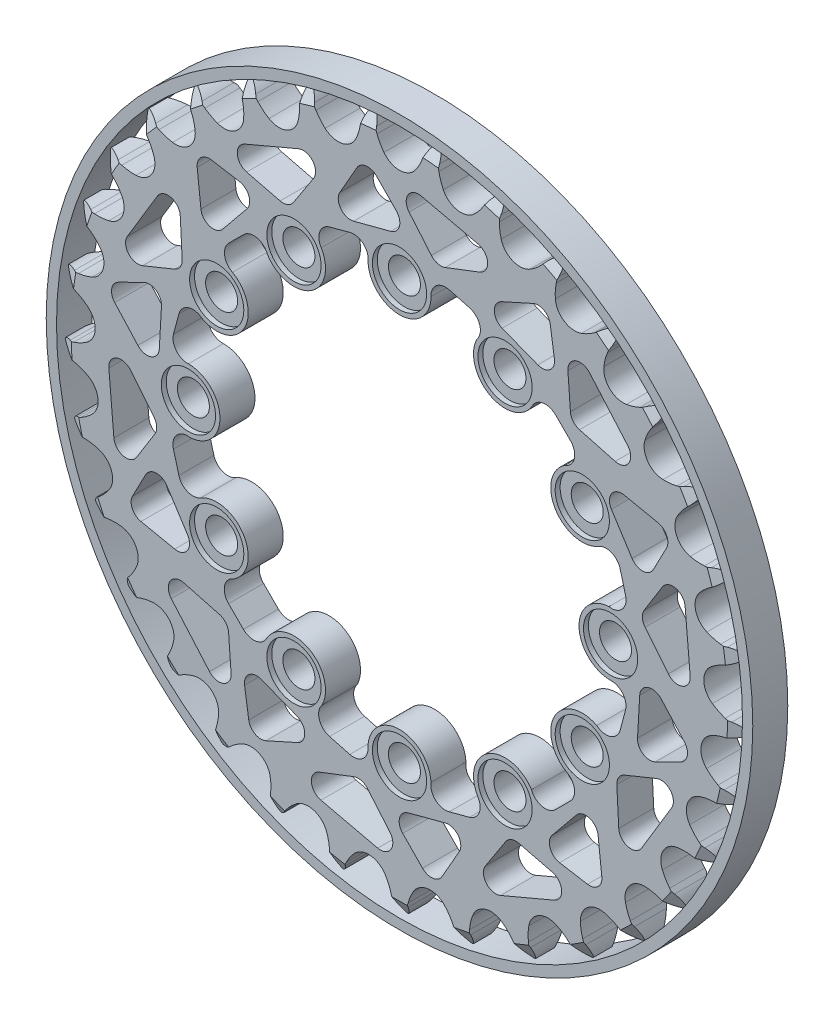
from build123d import *

# Parameters (mm, degrees)
EXTRUSION_DEPTH         = 7.2136
CIRPATTERN1_COUNT       = 12
CUT_EXTRUDE1_DEPTH      = 101.397293257
CUT_EXTRUDE1_DEPTH_BACK = 101.397293257
SKETCH8_R               = 37
CUT_EXTRUDE2_START      = 7.2136
SKETCH10_R              = 5.588
CUT_EXTRUDE2_DEPTH      = 1.016
CIRPATTERN2_COUNT       = 12
CUT_EXTRUDE3_DEPTH      = 101.397293405
CIRPATTERN3_COUNT       = 12
CUT_EXTRUDE4_DEPTH      = 101.397293405
CIRPATTERN5_COUNT       = 10
SKETCH16_R              = 72.810185918
SKETCH16_R_2            = 70.692441337
BOSS_EXTRUDE1_DEPTH     = 7.2136


with BuildPart() as part:
    # Teeth Sketch → Extrusion (new body)
    with BuildSketch(Plane.XY):
        with BuildLine():
            Line((5.022388138, 68.006393031), (4.635162245, 66.971544668))
            ThreePointArc((4.635162245, 66.971544668), (4.0137299, 65.635158722), (3.209237245, 64.400291471))
            ThreePointArc((3.209237245, 64.400291471), (0, 62.793862006), (-3.209237245, 64.400291471))
            ThreePointArc((-3.209237245, 64.400291471), (-4.0137299, 65.635158722), (-4.635162245, 66.971544668))
            Line((-4.635162245, 66.971544668), (-5.022388138, 68.006393031))
            ThreePointArc((-5.022388138, 68.006393031), (-5.727412099, 69.369502295), (-6.734552875, 70.527428506))
            ThreePointArc((-6.734552875, 70.527428506), (-7.504354329, 69.199824885), (-7.938667464, 67.727922119))
            Line((-7.938667464, 67.727922119), (-8.123049341, 66.638491832))
            ThreePointArc((-8.123049341, 66.638491832), (-8.48033889, 65.208649276), (-9.036593151, 63.84384645))
            ThreePointArc((-9.036593151, 63.84384645), (-11.883816523, 61.659095115), (-15.339077445, 62.629142165))
            ThreePointArc((-15.339077445, 62.629142165), (-16.362732034, 63.68944252), (-17.22584699, 64.884071387))
            Line((-17.22584699, 64.884071387), (-17.801921547, 65.826935709))
            ThreePointArc((-17.801921547, 65.826935709), (-18.752174931, 67.031985151), (-19.960254337, 67.978383482))
            ThreePointArc((-19.960254337, 67.978383482), (-20.464893839, 66.529085505), (-20.61279894, 65.001587639))
            Line((-20.61279894, 65.001587639), (-20.587672758, 63.896950277))
            ThreePointArc((-20.587672758, 63.896950277), (-20.667906137, 62.425329346), (-20.955817525, 60.979918474))
            ThreePointArc((-20.955817525, 60.979918474), (-23.338120953, 58.295807876), (-26.914523421, 58.594412483))
            ThreePointArc((-26.914523421, 58.594412483), (-28.120342399, 59.441823925), (-29.193944743, 60.451518712))
            Line((-29.193944743, 60.451518712), (-29.938047129, 61.268321421))
            ThreePointArc((-29.938047129, 61.268321421), (-31.099185303, 62.271757414), (-32.464540202, 62.972422563))
            ThreePointArc((-32.464540202, 62.972422563), (-32.685778765, 61.453811636), (-32.541930156, 59.925926421))
            Line((-32.541930156, 59.925926421), (-32.308204042, 58.846006456))
            ThreePointArc((-32.308204042, 58.846006456), (-32.108481407, 57.385795366), (-32.117644055, 55.912017363))
            ThreePointArc((-32.117644055, 55.912017363), (-33.948924886, 52.825558252), (-37.517208396, 52.441928068))
            ThreePointArc((-37.517208396, 52.441928068), (-38.861610323, 53.045822938), (-40.106897269, 53.834090646))
            Line((-40.106897269, 53.834090646), (-40.992133685, 54.495310364))
            ThreePointArc((-40.992133685, 54.495310364), (-42.32219009, 55.260866117), (-43.795472998, 55.69047422))
            ThreePointArc((-43.795472998, 55.69047422), (-43.725314484, 54.157436897), (-43.294911229, 52.684386087))
            Line((-43.294911229, 52.684386087), (-42.861032653, 51.668214641))
            ThreePointArc((-42.861032653, 51.668214641), (-42.388572501, 50.272189225), (-42.118655247, 48.823310267))
            ThreePointArc((-42.118655247, 48.823310267), (-43.33272622, 45.446055318), (-46.763923708, 44.394055736))
            ThreePointArc((-46.763923708, 44.394055736), (-48.198318397, 44.732607702), (-49.570282031, 45.270958281))
            Line((-49.570282031, 45.270958281), (-50.564657725, 45.752696804))
            ThreePointArc((-50.564657725, 45.752696804), (-52.015560657, 46.252703137), (-53.543523293, 46.395727039))
            ThreePointArc((-53.543523293, 46.395727039), (-53.184503413, 44.903671283), (-52.483101407, 43.538694772))
            Line((-52.483101407, 43.538694772), (-51.864751871, 42.622998928))
            ThreePointArc((-51.864751871, 42.622998928), (-51.136630142, 41.341615182), (-50.597388499, 39.970001531))
            ThreePointArc((-50.597388499, 39.970001531), (-51.150369926, 36.424013535), (-54.320468976, 34.741666562))
            ThreePointArc((-54.320468976, 34.741666562), (-55.793013665, 34.802639473), (-57.242067645, 35.071615531))
            Line((-57.242067645, 35.071615531), (-58.309643291, 35.356461573))
            ThreePointArc((-58.309643291, 35.356461573), (-59.828953337, 35.572846956), (-61.356371149, 35.424117399))
            ThreePointArc((-61.356371149, 35.424117399), (-60.721465817, 34.026969994), (-59.774415556, 32.819401589))
            Line((-59.774415556, 32.819401589), (-58.993943824, 32.037276981))
            ThreePointArc((-58.993943824, 32.037276981), (-58.036476735, 30.916847451), (-57.2474003, 29.672072798))
            ThreePointArc((-57.2474003, 29.672072798), (-57.119305992, 26.085513002), (-59.913730964, 23.83362304))
            ThreePointArc((-59.913730964, 23.83362304), (-61.371204052, 23.614813176), (-62.844975793, 23.604693218))
            Line((-62.844975793, 23.604693218), (-63.947166423, 23.682351702))
            ThreePointArc((-63.947166423, 23.682351702), (-65.479971761, 23.607295402), (-66.951639889, 23.17218786))
            ThreePointArc((-66.951639889, 23.17218786), (-66.063796239, 21.920445353), (-64.905326586, 20.913929722))
            Line((-64.905326586, 20.913929722), (-63.99094094, 20.293644371))
            ThreePointArc((-63.99094094, 20.293644371), (-62.838733846, 19.374664301), (-61.828341898, 18.301718044))
            ThreePointArc((-61.828341898, 18.301718044), (-61.023801517, 14.804214063), (-63.341554612, 12.064170283))
            ThreePointArc((-63.341554612, 12.064170283), (-64.731279223, 11.573486003), (-66.176502774, 11.28463579))
            Line((-66.176502774, 11.28463579), (-67.273472348, 11.152299936))
            ThreePointArc((-67.273472348, 11.152299936), (-68.764373399, 10.788514683), (-70.127101923, 10.082755077))
            ThreePointArc((-70.127101923, 10.082755077), (-69.018408937, 9.021658703), (-67.690390004, 8.252573944))
            Line((-67.690390004, 8.252573944), (-66.675138724, 7.816546579))
            ThreePointArc((-66.675138724, 7.816546579), (-65.369835391, 7.132230303), (-64.174646128, 6.269891516))
            ThreePointArc((-64.174646128, 6.269891516), (-62.722737859, 2.987852256), (-64.480049441, -0.14131302))
            ThreePointArc((-64.480049441, -0.14131302), (-65.751797307, -0.886137108), (-67.116238523, -1.443277777))
            Line((-67.116238523, -1.443277777), (-68.168339704, -1.780825007))
            ThreePointArc((-68.168339704, -1.780825007), (-69.563451418, -2.420191065), (-70.767987779, -3.371094744))
            ThreePointArc((-70.767987779, -3.371094744), (-69.478516511, -4.203194198), (-68.028946362, -4.707051357))
            Line((-68.028946362, -4.707051357), (-66.949523274, -4.943061572))
            ThreePointArc((-66.949523274, -4.943061572), (-65.538300765, -5.367981082), (-64.201511441, -5.988545228))
            ThreePointArc((-64.201511441, -5.988545228), (-62.154711032, -8.936498316), (-63.288067282, -12.341688903))
            ThreePointArc((-63.288067282, -12.341688903), (-64.395874122, -13.313732915), (-65.630218543, -14.119027525))
            Line((-65.630218543, -14.119027525), (-66.599425651, -14.649586294))
            ThreePointArc((-66.599425651, -14.649586294), (-67.848325057, -15.541424803), (-68.851134172, -16.703104419))
            ThreePointArc((-68.851134172, -16.703104419), (-67.427489473, -17.276132709), (-65.908759351, -17.496551559))
            Line((-65.908759351, -17.496551559), (-64.804177617, -17.524014599))
            ThreePointArc((-64.804177617, -17.524014599), (-63.338041192, -17.674179644), (-61.907966855, -18.030540344))
            ThreePointArc((-61.907966855, -18.030540344), (-59.340251006, -20.537860555), (-59.808689476, -24.096003993))
            ThreePointArc((-59.808689476, -24.096003993), (-60.712516265, -25.260135726), (-61.772151467, -26.284478831))
            Line((-61.772151467, -26.284478831), (-62.623434833, -26.988873364))
            ThreePointArc((-62.623434833, -26.988873364), (-63.680983452, -28.100950955), (-64.445821187, -29.43142038))
            ThreePointArc((-64.445821187, -29.43142038), (-62.939457285, -29.724666771), (-61.406458053, -29.6536808))
            Line((-61.406458053, -29.6536808), (-60.316640136, -29.471604079))
            ThreePointArc((-60.316640136, -29.471604079), (-58.848579784, -29.341587304), (-57.376907048, -29.420864754))
            ThreePointArc((-57.376907048, -29.420864754), (-54.381079699, -31.396931003), (-54.167669802, -34.979426717))
            ThreePointArc((-54.167669802, -34.979426717), (-54.834849884, -36.293571418), (-55.681477891, -37.499940589))
            Line((-55.681477891, -37.499940589), (-56.384069915, -38.352712231))
            ThreePointArc((-56.384069915, -38.352712231), (-57.212045185, -39.644835523), (-57.711268312, -41.096008126))
            ThreePointArc((-57.711268312, -41.096008126), (-56.176629123, -41.09887393), (-54.684767369, -40.739048756))
            Line((-54.684767369, -40.739048756), (-53.649102126, -40.354013001))
            ThreePointArc((-53.649102126, -40.354013001), (-52.232177374, -39.94851355), (-50.772096325, -39.747842457))
            ThreePointArc((-50.772096325, -39.747842457), (-47.456434483, -41.12123456), (-46.56888941, -44.598601821))
            ThreePointArc((-46.56888941, -44.598601821), (-46.975309158, -46.015262876), (-47.578330627, -47.360056788))
            Line((-47.578330627, -47.360056788), (-48.106837804, -48.330384151))
            ThreePointArc((-48.106837804, -48.330384151), (-48.675314541, -49.755852442), (-48.890879835, -51.275279063))
            ThreePointArc((-48.890879835, -51.275279063), (-47.383431219, -50.987660703), (-45.986626711, -50.352001344))
            Line((-45.986626711, -50.352001344), (-45.042545785, -49.777922752))
            ThreePointArc((-45.042545785, -49.777922752), (-43.727967985, -49.111596431), (-42.332249756, -48.638229571))
            ThreePointArc((-42.332249756, -48.638229571), (-38.816590078, -49.35930956), (-37.28698802, -52.605867255))
            ThreePointArc((-37.28698802, -52.605867255), (-37.417958367, -54.073842843), (-37.75557853, -55.50845714))
            Line((-37.75557853, -55.50845714), (-38.090899233, -56.561270064))
            ThreePointArc((-38.090899233, -56.561270064), (-38.379331208, -58.068563217), (-38.303447577, -59.601327819))
            ThreePointArc((-38.303447577, -59.601327819), (-36.877672653, -59.03362057), (-35.626409548, -58.145101414))
            Line((-35.626409548, -58.145101414), (-34.808034481, -57.402728679))
            ThreePointArc((-34.808034481, -57.402728679), (-33.6433159, -56.499658259), (-32.362405386, -55.770704343))
            ThreePointArc((-32.362405386, -55.770704343), (-28.773812973, -55.813410509), (-26.657437732, -58.711819583))
            ThreePointArc((-26.657437732, -58.711819583), (-26.508225068, -60.178053241), (-26.568241455, -61.650637225))
            Line((-26.568241455, -61.650637225), (-26.69825632, -62.747884308))
            ThreePointArc((-26.69825632, -62.747884308), (-26.696218847, -64.28252482), (-26.331628924, -65.773229298))
            ThreePointArc((-26.331628924, -65.773229298), (-25.039058915, -64.94595158), (-23.978561119, -63.836686022))
            Line((-23.978561119, -63.836686022), (-23.31547012, -62.952850431))
            ThreePointArc((-23.31547012, -62.952850431), (-22.342706722, -61.845675228), (-21.222899365, -60.887480551))
            ThreePointArc((-21.222899365, -60.887480551), (-17.691075297, -60.250269381), (-15.06441819, -62.69577378))
            ThreePointArc((-15.06441819, -62.69577378), (-14.640415448, -64.107272002), (-14.42065891, -65.564602652))
            Line((-14.42065891, -65.564602652), (-14.340668861, -66.666626525))
            ThreePointArc((-14.340668861, -66.666626525), (-14.048235582, -68.17314849), (-13.408116596, -69.567914899))
            ThreePointArc((-13.408116596, -69.567914899), (-12.295468348, -68.510966685), (-11.464065017, -67.221046473))
            Line((-11.464065017, -67.221046473), (-10.980223921, -66.227692145))
            ThreePointArc((-10.980223921, -66.227692145), (-10.23457391, -64.956428358), (-9.316342465, -63.80362457))
            ThreePointArc((-9.316342465, -63.80362457), (-5.968936066, -62.509526537), (-2.926931324, -64.413739359))
            ThreePointArc((-2.926931324, -64.413739359), (-2.24346307, -65.719486924), (-1.751876179, -67.108892511))
            Line((-1.751876179, -67.108892511), (-1.464772265, -68.175863162))
            ThreePointArc((-1.464772265, -68.175863162), (-0.89251248, -69.59981695), (0, -70.848234798))
            ThreePointArc((0, -70.848234798), (0.89251248, -69.59981695), (1.464772265, -68.175863162))
            Line((1.464772265, -68.175863162), (1.751876179, -67.108892511))
            ThreePointArc((1.751876179, -67.108892511), (2.24346307, -65.719486924), (2.926931324, -64.413739359))
            ThreePointArc((2.926931324, -64.413739359), (5.968936066, -62.509526537), (9.316342465, -63.80362457))
            ThreePointArc((9.316342465, -63.80362457), (10.23457391, -64.956428358), (10.980223921, -66.227692145))
            Line((10.980223921, -66.227692145), (11.464065017, -67.221046473))
            ThreePointArc((11.464065017, -67.221046473), (12.295468348, -68.510966685), (13.408116596, -69.567914899))
            ThreePointArc((13.408116596, -69.567914899), (14.048235582, -68.17314849), (14.340668861, -66.666626525))
            Line((14.340668861, -66.666626525), (14.42065891, -65.564602652))
            ThreePointArc((14.42065891, -65.564602652), (14.640415448, -64.107272002), (15.06441819, -62.69577378))
            ThreePointArc((15.06441819, -62.69577378), (17.691075297, -60.250269381), (21.222899365, -60.887480551))
            ThreePointArc((21.222899365, -60.887480551), (22.342706722, -61.845675228), (23.31547012, -62.952850431))
            Line((23.31547012, -62.952850431), (23.978561119, -63.836686022))
            ThreePointArc((23.978561119, -63.836686022), (25.039058915, -64.94595158), (26.331628924, -65.773229298))
            ThreePointArc((26.331628924, -65.773229298), (26.696218847, -64.28252482), (26.69825632, -62.747884308))
            Line((26.69825632, -62.747884308), (26.568241455, -61.650637225))
            ThreePointArc((26.568241455, -61.650637225), (26.508225068, -60.178053241), (26.657437732, -58.711819583))
            ThreePointArc((26.657437732, -58.711819583), (28.773812973, -55.813410509), (32.362405386, -55.770704343))
            ThreePointArc((32.362405386, -55.770704343), (33.6433159, -56.499658259), (34.808034481, -57.402728679))
            Line((34.808034481, -57.402728679), (35.626409548, -58.145101414))
            ThreePointArc((35.626409548, -58.145101414), (36.877672653, -59.03362057), (38.303447577, -59.601327819))
            ThreePointArc((38.303447577, -59.601327819), (38.379331208, -58.068563217), (38.090899233, -56.561270064))
            Line((38.090899233, -56.561270064), (37.75557853, -55.50845714))
            ThreePointArc((37.75557853, -55.50845714), (37.417958367, -54.073842843), (37.28698802, -52.605867255))
            ThreePointArc((37.28698802, -52.605867255), (38.816590078, -49.35930956), (42.332249756, -48.638229571))
            ThreePointArc((42.332249756, -48.638229571), (43.727967985, -49.111596431), (45.042545785, -49.777922752))
            Line((45.042545785, -49.777922752), (45.986626711, -50.352001344))
            ThreePointArc((45.986626711, -50.352001344), (47.383431219, -50.987660703), (48.890879835, -51.275279063))
            ThreePointArc((48.890879835, -51.275279063), (48.675314541, -49.755852442), (48.106837804, -48.330384151))
            Line((48.106837804, -48.330384151), (47.578330627, -47.360056788))
            ThreePointArc((47.578330627, -47.360056788), (46.975309158, -46.015262876), (46.56888941, -44.598601821))
            ThreePointArc((46.56888941, -44.598601821), (47.456434483, -41.12123456), (50.772096325, -39.747842457))
            ThreePointArc((50.772096325, -39.747842457), (52.232177374, -39.94851355), (53.649102126, -40.354013001))
            Line((53.649102126, -40.354013001), (54.684767369, -40.739048756))
            ThreePointArc((54.684767369, -40.739048756), (56.176629123, -41.09887393), (57.711268312, -41.096008126))
            ThreePointArc((57.711268312, -41.096008126), (57.212045185, -39.644835523), (56.384069915, -38.352712231))
            Line((56.384069915, -38.352712231), (55.681477891, -37.499940589))
            ThreePointArc((55.681477891, -37.499940589), (54.834849884, -36.293571418), (54.167669802, -34.979426717))
            ThreePointArc((54.167669802, -34.979426717), (54.381079699, -31.396931003), (57.376907048, -29.420864754))
            ThreePointArc((57.376907048, -29.420864754), (58.848579784, -29.341587304), (60.316640136, -29.471604079))
            Line((60.316640136, -29.471604079), (61.406458053, -29.6536808))
            ThreePointArc((61.406458053, -29.6536808), (62.939457285, -29.724666771), (64.445821187, -29.43142038))
            ThreePointArc((64.445821187, -29.43142038), (63.680983452, -28.100950955), (62.623434833, -26.988873364))
            Line((62.623434833, -26.988873364), (61.772151467, -26.284478831))
            ThreePointArc((61.772151467, -26.284478831), (60.712516265, -25.260135726), (59.808689476, -24.096003993))
            ThreePointArc((59.808689476, -24.096003993), (59.340251006, -20.537860555), (61.907966855, -18.030540344))
            ThreePointArc((61.907966855, -18.030540344), (63.338041192, -17.674179644), (64.804177617, -17.524014599))
            Line((64.804177617, -17.524014599), (65.908759351, -17.496551559))
            ThreePointArc((65.908759351, -17.496551559), (67.427489473, -17.276132709), (68.851134172, -16.703104419))
            ThreePointArc((68.851134172, -16.703104419), (67.848325057, -15.541424803), (66.599425651, -14.649586294))
            Line((66.599425651, -14.649586294), (65.630218543, -14.119027525))
            ThreePointArc((65.630218543, -14.119027525), (64.395874122, -13.313732915), (63.288067282, -12.341688903))
            ThreePointArc((63.288067282, -12.341688903), (62.154711032, -8.936498316), (64.201511441, -5.988545228))
            ThreePointArc((64.201511441, -5.988545228), (65.538300765, -5.367981082), (66.949523274, -4.943061572))
            Line((66.949523274, -4.943061572), (68.028946362, -4.707051357))
            ThreePointArc((68.028946362, -4.707051357), (69.478516511, -4.203194198), (70.767987779, -3.371094744))
            ThreePointArc((70.767987779, -3.371094744), (69.563451418, -2.420191065), (68.168339704, -1.780825007))
            Line((68.168339704, -1.780825007), (67.116238523, -1.443277777))
            ThreePointArc((67.116238523, -1.443277777), (65.751797307, -0.886137108), (64.480049441, -0.14131302))
            ThreePointArc((64.480049441, -0.14131302), (62.722737859, 2.987852256), (64.174646128, 6.269891516))
            ThreePointArc((64.174646128, 6.269891516), (65.369835391, 7.132230303), (66.675138724, 7.816546579))
            Line((66.675138724, 7.816546579), (67.690390004, 8.252573944))
            ThreePointArc((67.690390004, 8.252573944), (69.018408937, 9.021658703), (70.127101923, 10.082755077))
            ThreePointArc((70.127101923, 10.082755077), (68.764373399, 10.788514683), (67.273472348, 11.152299936))
            Line((67.273472348, 11.152299936), (66.176502774, 11.28463579))
            ThreePointArc((66.176502774, 11.28463579), (64.731279223, 11.573486003), (63.341554612, 12.064170283))
            ThreePointArc((63.341554612, 12.064170283), (61.023801517, 14.804214063), (61.828341898, 18.301718044))
            ThreePointArc((61.828341898, 18.301718044), (62.838733846, 19.374664301), (63.99094094, 20.293644371))
            Line((63.99094094, 20.293644371), (64.905326586, 20.913929722))
            ThreePointArc((64.905326586, 20.913929722), (66.063796239, 21.920445353), (66.951639889, 23.17218786))
            ThreePointArc((66.951639889, 23.17218786), (65.479971761, 23.607295402), (63.947166423, 23.682351702))
            Line((63.947166423, 23.682351702), (62.844975793, 23.604693218))
            ThreePointArc((62.844975793, 23.604693218), (61.371204052, 23.614813176), (59.913730964, 23.83362304))
            ThreePointArc((59.913730964, 23.83362304), (57.119305992, 26.085513002), (57.2474003, 29.672072798))
            ThreePointArc((57.2474003, 29.672072798), (58.036476735, 30.916847451), (58.993943824, 32.037276981))
            Line((58.993943824, 32.037276981), (59.774415556, 32.819401589))
            ThreePointArc((59.774415556, 32.819401589), (60.721465817, 34.026969994), (61.356371149, 35.424117399))
            ThreePointArc((61.356371149, 35.424117399), (59.828953337, 35.572846956), (58.309643291, 35.356461573))
            Line((58.309643291, 35.356461573), (57.242067645, 35.071615531))
            ThreePointArc((57.242067645, 35.071615531), (55.793013665, 34.802639473), (54.320468976, 34.741666562))
            ThreePointArc((54.320468976, 34.741666562), (51.150369926, 36.424013535), (50.597388499, 39.970001531))
            ThreePointArc((50.597388499, 39.970001531), (51.136630142, 41.341615182), (51.864751871, 42.622998928))
            Line((51.864751871, 42.622998928), (52.483101407, 43.538694772))
            ThreePointArc((52.483101407, 43.538694772), (53.184503413, 44.903671283), (53.543523293, 46.395727039))
            ThreePointArc((53.543523293, 46.395727039), (52.015560657, 46.252703137), (50.564657725, 45.752696804))
            Line((50.564657725, 45.752696804), (49.570282031, 45.270958281))
            ThreePointArc((49.570282031, 45.270958281), (48.198318397, 44.732607702), (46.763923708, 44.394055736))
            ThreePointArc((46.763923708, 44.394055736), (43.33272622, 45.446055318), (42.118655247, 48.823310267))
            ThreePointArc((42.118655247, 48.823310267), (42.388572501, 50.272189225), (42.861032653, 51.668214641))
            Line((42.861032653, 51.668214641), (43.294911229, 52.684386087))
            ThreePointArc((43.294911229, 52.684386087), (43.725314484, 54.157436897), (43.795472998, 55.69047422))
            ThreePointArc((43.795472998, 55.69047422), (42.32219009, 55.260866117), (40.992133685, 54.495310364))
            Line((40.992133685, 54.495310364), (40.106897269, 53.834090646))
            ThreePointArc((40.106897269, 53.834090646), (38.861610323, 53.045822938), (37.517208396, 52.441928068))
            ThreePointArc((37.517208396, 52.441928068), (33.948924886, 52.825558252), (32.117644055, 55.912017363))
            ThreePointArc((32.117644055, 55.912017363), (32.108481407, 57.385795366), (32.308204042, 58.846006456))
            Line((32.308204042, 58.846006456), (32.541930156, 59.925926421))
            ThreePointArc((32.541930156, 59.925926421), (32.685778765, 61.453811636), (32.464540202, 62.972422563))
            ThreePointArc((32.464540202, 62.972422563), (31.099185303, 62.271757414), (29.938047129, 61.268321421))
            Line((29.938047129, 61.268321421), (29.193944743, 60.451518712))
            ThreePointArc((29.193944743, 60.451518712), (28.120342399, 59.441823925), (26.914523421, 58.594412483))
            ThreePointArc((26.914523421, 58.594412483), (23.338120953, 58.295807876), (20.955817525, 60.979918474))
            ThreePointArc((20.955817525, 60.979918474), (20.667906137, 62.425329346), (20.587672758, 63.896950277))
            Line((20.587672758, 63.896950277), (20.61279894, 65.001587639))
            ThreePointArc((20.61279894, 65.001587639), (20.464893839, 66.529085505), (19.960254337, 67.978383482))
            ThreePointArc((19.960254337, 67.978383482), (18.752174931, 67.031985151), (17.801921547, 65.826935709))
            Line((17.801921547, 65.826935709), (17.22584699, 64.884071387))
            ThreePointArc((17.22584699, 64.884071387), (16.362732034, 63.68944252), (15.339077445, 62.629142165))
            ThreePointArc((15.339077445, 62.629142165), (11.883816523, 61.659095115), (9.036593151, 63.84384645))
            ThreePointArc((9.036593151, 63.84384645), (8.48033889, 65.208649276), (8.123049341, 66.638491832))
            Line((8.123049341, 66.638491832), (7.938667464, 67.727922119))
            ThreePointArc((7.938667464, 67.727922119), (7.504354329, 69.199824885), (6.734552875, 70.527428506))
            ThreePointArc((6.734552875, 70.527428506), (5.727412099, 69.369502295), (5.022388138, 68.006393031))
        make_face()
    extrude(amount=EXTRUSION_DEPTH)

    # Sketch7 → M6 Clearance Hole1 (revolve, cut)
    with BuildSketch(Plane(origin=(0, 43.500000122, 0), x_dir=(0, 1, 0), z_dir=(1, 0, 0))):
        Polygon((0, 0), (0, 19.254840043), (3.3, 17.272), (3.3, 0), align=None)
    m6_clearance_hole1 = revolve(axis=Axis((0, 43.500000122, -6.35), (0, 0, 1)), mode=Mode.SUBTRACT)

    # CirPattern1: M6 Clearance Hole1 ×12 about axis
    cirpattern1_axis = Axis((0, 0, 0), (0, 0, 1))
    for i in range(1, CIRPATTERN1_COUNT):
        add(m6_clearance_hole1.rotate(cirpattern1_axis, i * 360 / CIRPATTERN1_COUNT), mode=Mode.SUBTRACT)

    # Sketch8 → Cut-Extrude1 (cut, two sides: drawn at the far end of the back side and taken through both)
    with BuildSketch(Plane(origin=(0, 0, 0), x_dir=(-1, 0, 0), z_dir=(0, 0, -1)).offset(-CUT_EXTRUDE1_DEPTH_BACK)):
        Circle(SKETCH8_R)
    extrude(amount=CUT_EXTRUDE1_DEPTH + CUT_EXTRUDE1_DEPTH_BACK, mode=Mode.SUBTRACT)

    # Sketch5 → Cut-Revolve1 (revolve, cut)
    with BuildSketch(Plane(origin=(0, 0, 0), x_dir=(0, 0, -1), z_dir=(1, 0, 0))):
        Polygon((-7.2136, -67.654652666), (-7.2136, -70.848234798), (-5.3848, -70.848234798), align=None)
    cut_revolve1 = revolve(axis=Axis((0, 0, 7.2136), (0, 0, -1)), mode=Mode.SUBTRACT)

    # Mirror1: Cut-Revolve1 across plane
    add(cut_revolve1.mirror(Plane.XY.offset(3.6068)), mode=Mode.SUBTRACT)

    # Sketch10 → Cut-Extrude2 (cut)
    with BuildSketch(Plane.XY.offset(CUT_EXTRUDE2_START)):
        with Locations((-43.500000122, 0)):
            Circle(SKETCH10_R)
    cut_extrude2 = extrude(amount=-CUT_EXTRUDE2_DEPTH, mode=Mode.SUBTRACT)

    # CirPattern2: Cut-Extrude2 ×12 about axis
    cirpattern2_axis = Axis((0, 0, 0), (0, 0, 1))
    for i in range(1, CIRPATTERN2_COUNT):
        add(cut_extrude2.rotate(cirpattern2_axis, i * 360 / CIRPATTERN2_COUNT), mode=Mode.SUBTRACT)

    # Sketch12 → Cut-Extrude3 (cut, through all)
    with BuildSketch(Plane.XY.offset(7.2136)):
        with BuildLine():
            Line((10.247557334, 46.58614006), (14.418425052, 45.468559424))
            ThreePointArc((14.418425052, 45.468559424), (16.52512006, 43.476131789), (15.962793017, 40.631536909))
            ThreePointArc((15.962793017, 40.631536909), (15.516319163, 35.83057753), (18.5, 32.04293994))
            ThreePointArc((18.5, 32.04293994), (9.576304669, 35.739255573), (0, 37))
            ThreePointArc((0, 37), (4.596194164, 38.903805958), (6.500000122, 43.500000122))
            ThreePointArc((6.500000122, 43.500000122), (7.587792196, 45.997508178), (10.247557334, 46.58614006))
        make_face()
    cut_extrude3 = extrude(amount=-CUT_EXTRUDE3_DEPTH, mode=Mode.SUBTRACT)

    # CirPattern3: Cut-Extrude3 ×12 about axis
    cirpattern3_axis = Axis((0, 0, 0), (0, 0, 1))
    for i in range(1, CIRPATTERN3_COUNT):
        add(cut_extrude3.rotate(cirpattern3_axis, i * 360 / CIRPATTERN3_COUNT), mode=Mode.SUBTRACT)

    # Sketch13 → Cut-Extrude4 (cut, through all)
    with BuildSketch(Plane.XY.offset(7.2136)):
        with BuildLine():
            Line((-12.29503781, 52.699348233), (-8.766956721, 58.874555746))
            ThreePointArc((-8.766956721, 58.874555746), (-6.886929375, 60.133596514), (-4.748676784, 59.393621964))
            Line((-4.748676784, 59.393621964), (-0.656757873, 55.224069994))
            ThreePointArc((-0.656757873, 55.224069994), (-0.020757561, 52.770631729), (-1.823075281, 50.988636624))
            Line((-1.823075281, 50.988636624), (-9.443075281, 48.982981081))
            ThreePointArc((-9.443075281, 48.982981081), (-12.104647123, 49.892965008), (-12.29503781, 52.699348233))
        make_face()
        with BuildLine():
            Line((1.979717897, 56.320855635), (6.567308468, 50.886285113))
            ThreePointArc((6.567308468, 50.886285113), (7.875401815, 50.064805257), (9.417527045, 50.153050025))
            Line((9.417527045, 50.153050025), (16.53250792, 52.880951625))
            ThreePointArc((16.53250792, 52.880951625), (18.15709085, 55.428778294), (16.195570256, 57.727283763))
            Line((16.195570256, 57.727283763), (4.49299881, 60.433952684))
            ThreePointArc((4.49299881, 60.433952684), (1.753234812, 59.28365705), (1.979717897, 56.320855635))
        make_face()
    cut_extrude4 = extrude(amount=-CUT_EXTRUDE4_DEPTH, mode=Mode.SUBTRACT)

    # CirPattern5: Cut-Extrude4 ×10 about axis
    cirpattern5_axis = Axis((0, 0, 0), (0, 0, 1))
    for i in range(1, CIRPATTERN5_COUNT):
        add(cut_extrude4.rotate(cirpattern5_axis, i * 360 / CIRPATTERN5_COUNT), mode=Mode.SUBTRACT)


with BuildPart() as body_2:
    # Sketch16 → Boss-Extrude1 (new body)
    with BuildSketch(Plane.XY):
        Circle(SKETCH16_R)
        Circle(SKETCH16_R_2, mode=Mode.SUBTRACT)
    extrude(amount=BOSS_EXTRUDE1_DEPTH)


solid = Compound([part.part, body_2.part])
